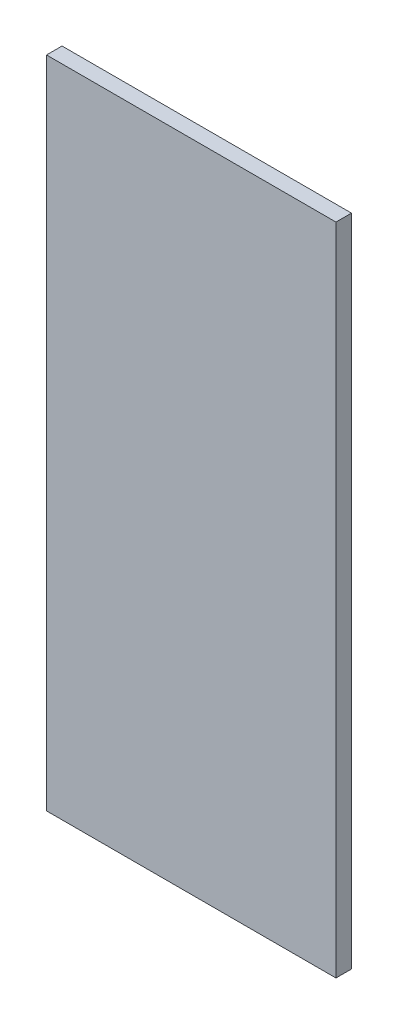
from build123d import *

# Parameters (mm, degrees)
SKETCH1_W           = 168
SKETCH1_H           = 380
BOSS_EXTRUDE1_DEPTH = 9


with BuildPart() as part:
    # Sketch1 → Boss-Extrude1 (new body)
    with BuildSketch(Plane.XY):
        Rectangle(SKETCH1_W, SKETCH1_H)
    extrude(amount=BOSS_EXTRUDE1_DEPTH)


solid = part.part
